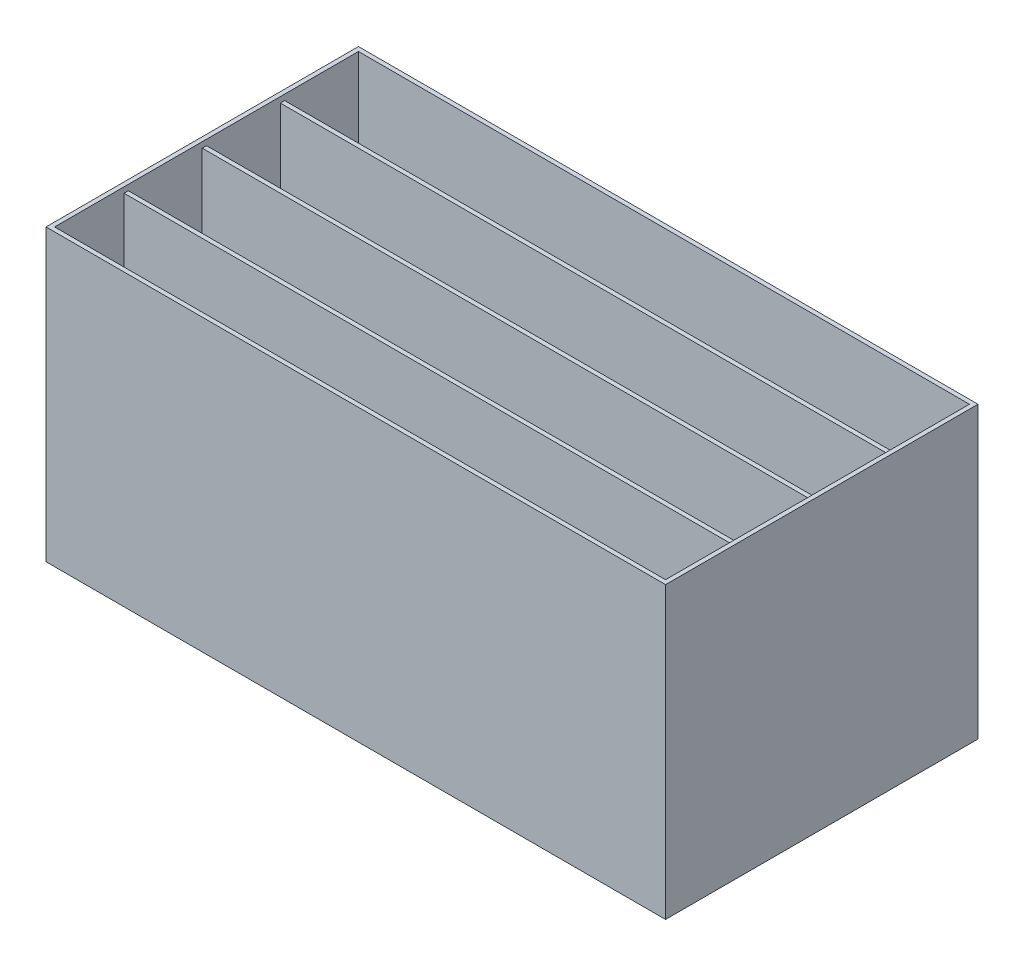
from build123d import *

# Parameters (mm, degrees)
SKETCH1_W                       = 919.1625
SKETCH1_H                       = 463.55
BOSS_EXTRUDE1_DEPTH             = 430.2125
SHELL1_T                        = -6.35
BOSS_EXTRUDE2_REACH             = 1103.337
SKETCH2_W                       = 906.4625
SKETCH2_H                       = 6.35
BOSS_EXTRUDE2_DIRECTION_2_DEPTH = 30.48


with BuildPart() as part:
    # Sketch1 → Boss-Extrude1 (new body)
    with BuildSketch(Plane(origin=(0, 0, 0), x_dir=(1, 0, 0), z_dir=(0, 1, 0))):
        with Locations((459.58125, 231.775)):
            Rectangle(SKETCH1_W, SKETCH1_H)
    extrude(amount=BOSS_EXTRUDE1_DEPTH)

    # Shell1
    shell1_openings = [part.faces().sort_by_distance(p)[0] for p in [
        (459.58125, 430.2125, -231.775),
    ]]
    offset(amount=SHELL1_T, openings=shell1_openings, kind=Kind.INTERSECTION)

    # Sketch2 → Boss-Extrude2 (add, up to next)
    with BuildSketch(Plane(origin=(0, 391.414, 0), x_dir=(1, 0, 0), z_dir=(0, 1, 0)), mode=Mode.PRIVATE) as boss_extrude2_sk1:
        with Locations((459.58125, 344.4875)):
            Rectangle(SKETCH2_W, SKETCH2_H)
    boss_extrude2_tool1 = extrude(boss_extrude2_sk1.sketch, amount=-BOSS_EXTRUDE2_REACH, mode=Mode.PRIVATE) - part.part
    # Sketch2 → Boss-Extrude2 (add, up to next)
    with BuildSketch(Plane(origin=(0, 391.414, 0), x_dir=(1, 0, 0), z_dir=(0, 1, 0)), mode=Mode.PRIVATE) as boss_extrude2_sk2:
        with Locations((459.58125, 228.6)):
            Rectangle(SKETCH2_W, SKETCH2_H)
    boss_extrude2_tool2 = extrude(boss_extrude2_sk2.sketch, amount=-BOSS_EXTRUDE2_REACH, mode=Mode.PRIVATE) - part.part
    # Sketch2 → Boss-Extrude2 (add, up to next)
    with BuildSketch(Plane(origin=(0, 391.414, 0), x_dir=(1, 0, 0), z_dir=(0, 1, 0)), mode=Mode.PRIVATE) as boss_extrude2_sk3:
        with Locations((459.58125, 112.7125)):
            Rectangle(SKETCH2_W, SKETCH2_H)
    boss_extrude2_tool3 = extrude(boss_extrude2_sk3.sketch, amount=-BOSS_EXTRUDE2_REACH, mode=Mode.PRIVATE) - part.part
    add(boss_extrude2_tool1.solids().sort_by_distance((459.58125, 391.414, -344.4875))[0])
    add(boss_extrude2_tool2.solids().sort_by_distance((459.58125, 391.414, -228.6))[0])
    add(boss_extrude2_tool3.solids().sort_by_distance((459.58125, 391.414, -112.7125))[0])

    # Sketch2 → Boss-Extrude2 direction 2 (add)
    with BuildSketch(Plane(origin=(0, 391.414, 0), x_dir=(1, 0, 0), z_dir=(0, 1, 0))):
        with Locations((459.58125, 344.4875)):
            Rectangle(SKETCH2_W, SKETCH2_H)
        with Locations((459.58125, 228.6)):
            Rectangle(SKETCH2_W, SKETCH2_H)
        with Locations((459.58125, 112.7125)):
            Rectangle(SKETCH2_W, SKETCH2_H)
    extrude(amount=BOSS_EXTRUDE2_DIRECTION_2_DEPTH)


solid = part.part
